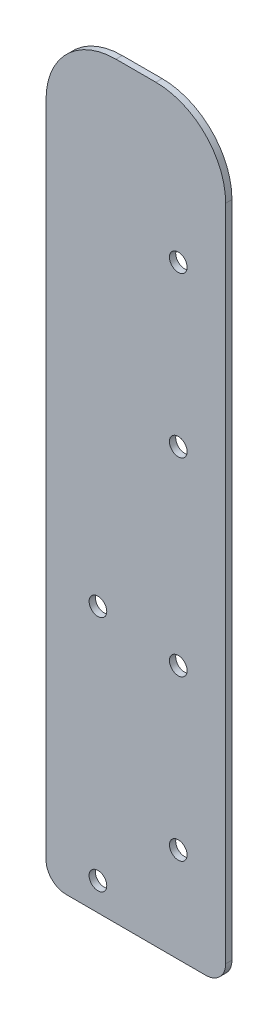
from build123d import *

# Parameters (mm, degrees)
SKETCH1_R           = 2.2479
BOSS_EXTRUDE2_DEPTH = 1.6002


with BuildPart() as part:
    # Sketch1 → Boss-Extrude2 (new body)
    with BuildSketch(Plane.XY):
        with BuildLine():
            Line((45.72, 5.08), (45.72, 172.72))
            ThreePointArc((45.72, 172.72), (40.512358569, 185.292358569), (27.94, 190.5))
            Line((27.94, 190.5), (17.78, 190.5))
            ThreePointArc((17.78, 190.5), (5.207641431, 185.292358569), (0, 172.72))
            Line((0, 172.72), (0, 5.08))
            ThreePointArc((0, 5.08), (1.503493452, 1.526611814), (5.070014314, 0.054542149))
            Line((5.070014314, 0.054542149), (33.655, 0))
            Line((33.655, 0), (40.64, 0))
            ThreePointArc((40.64, 0), (44.232102448, 1.487897552), (45.72, 5.08))
        make_face()
        with Locations((33.655, 24.13)):
            Circle(SKETCH1_R, mode=Mode.SUBTRACT)
        with Locations((33.655, 64.77)):
            Circle(SKETCH1_R, mode=Mode.SUBTRACT)
        with Locations((33.655, 113.03)):
            Circle(SKETCH1_R, mode=Mode.SUBTRACT)
        with Locations((33.655, 153.67)):
            Circle(SKETCH1_R, mode=Mode.SUBTRACT)
        with Locations((13.208, 7.15102725)):
            Circle(SKETCH1_R, mode=Mode.SUBTRACT)
        with Locations((13.208, 67.603137295)):
            Circle(SKETCH1_R, mode=Mode.SUBTRACT)
    extrude(amount=BOSS_EXTRUDE2_DEPTH)


solid = part.part
